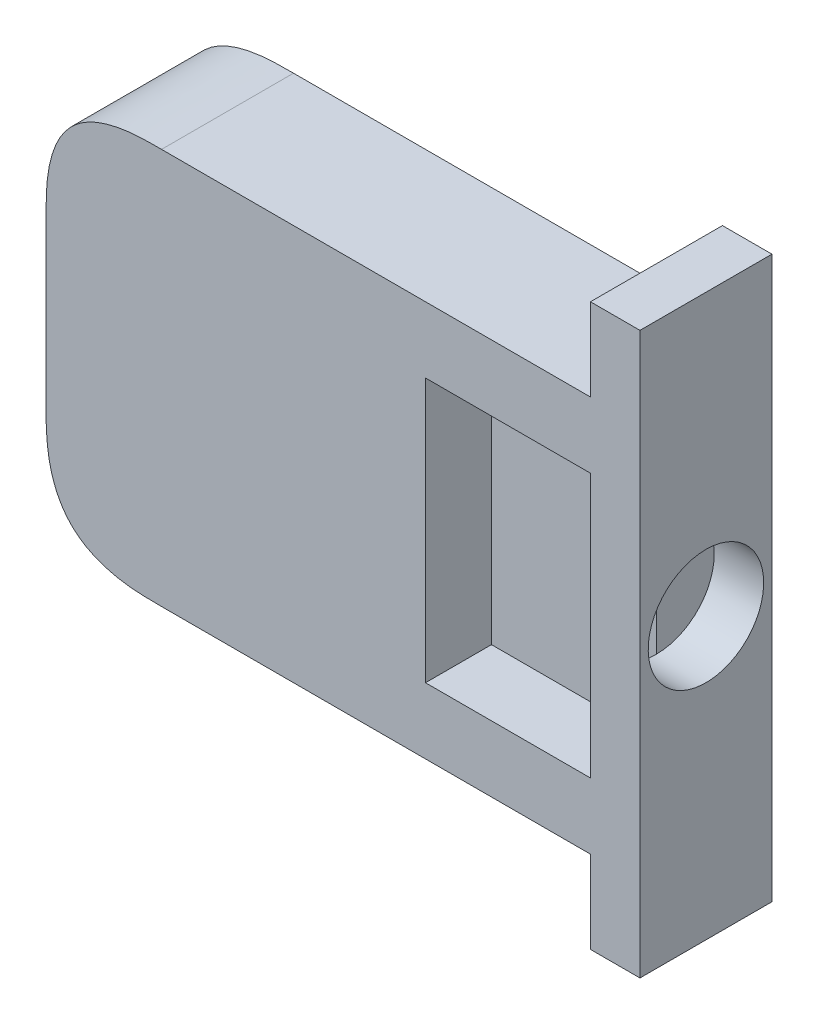
from build123d import *

# Parameters (mm, degrees)
BOSS_EXTRUDE1_DEPTH = 8
FILLET3_SIZE        = 7
SKETCH2_W           = 10
SKETCH2_H           = 8
CUT_EXTRUDE1_DEPTH  = 4
SKETCH3_R           = 3.5
CUT_EXTRUDE2_DEPTH  = 3


with BuildPart() as part:
    # Sketch1 → Boss-Extrude1 (new body)
    with BuildSketch(Plane.XY):
        Polygon((-6, -12), (-6, 12), (27, 12), (27, 17), (30, 17), (30, -17), (27, -17), (27, -12), align=None)
    extrude(amount=BOSS_EXTRUDE1_DEPTH)

    # Fillet3
    # a fillet whose section is not a circle: 7 mm, written as the material it takes off along each edge
    with BuildSketch(Plane(origin=(-6, 12, -17.5), x_dir=(0, -1, 0), z_dir=(0, 0, 1))) as fillet3_piece_1:
        with BuildLine():
            add(Edge.make_bspline([(FILLET3_SIZE, 0), (FILLET3_SIZE * 0.831801948466, 0), (FILLET3_SIZE * 0.663603896932, 0), (FILLET3_SIZE * 0.292893218813, FILLET3_SIZE * 0.0716919198361), (FILLET3_SIZE * 0.0716919198361, FILLET3_SIZE * 0.292893218813), (0, FILLET3_SIZE * 0.663603896932), (0, FILLET3_SIZE * 0.831801948466), (0, FILLET3_SIZE)], knots=[0, 0, 0, 0, 0, 0, 0.5, 0.5, 1, 1, 1, 1, 1, 1], degree=5))
            Line((0, FILLET3_SIZE), (0, 0))
            Line((0, 0), (FILLET3_SIZE, 0))
        make_face()
    extrude(amount=43, mode=Mode.SUBTRACT)
    with BuildSketch(Plane(origin=(-6, -12, -17.5), x_dir=(0, 1, 0), z_dir=(0, 0, 1))) as fillet3_piece_2:
        with BuildLine():
            add(Edge.make_bspline([(FILLET3_SIZE, 0), (FILLET3_SIZE * 0.831801948466, 0), (FILLET3_SIZE * 0.663603896932, 0), (FILLET3_SIZE * 0.292893218813, -FILLET3_SIZE * 0.0716919198361), (FILLET3_SIZE * 0.0716919198361, -FILLET3_SIZE * 0.292893218813), (0, -FILLET3_SIZE * 0.663603896932), (0, -FILLET3_SIZE * 0.831801948466), (0, -FILLET3_SIZE)], knots=[0, 0, 0, 0, 0, 0, 0.5, 0.5, 1, 1, 1, 1, 1, 1], degree=5))
            Line((0, -FILLET3_SIZE), (0, 0))
            Line((0, 0), (FILLET3_SIZE, 0))
        make_face()
    extrude(amount=43, mode=Mode.SUBTRACT)

    # Sketch2 → Cut-Extrude1 (cut)
    with BuildSketch(Plane.XY.offset(8)):
        with Locations((22, 4)):
            Rectangle(SKETCH2_W, SKETCH2_H)
        with Locations((22, -4)):
            Rectangle(SKETCH2_W, SKETCH2_H)
    extrude(amount=-CUT_EXTRUDE1_DEPTH, mode=Mode.SUBTRACT)

    # Sketch3 → Cut-Extrude2 (cut)
    with BuildSketch(Plane(origin=(30, 0, 0), x_dir=(0, 0, -1), z_dir=(1, 0, 0))):
        with Locations(Location((-4, 0, 0), (0, 0, 90))):
            Circle(SKETCH3_R)
    extrude(amount=-CUT_EXTRUDE2_DEPTH, mode=Mode.SUBTRACT)


solid = part.part
